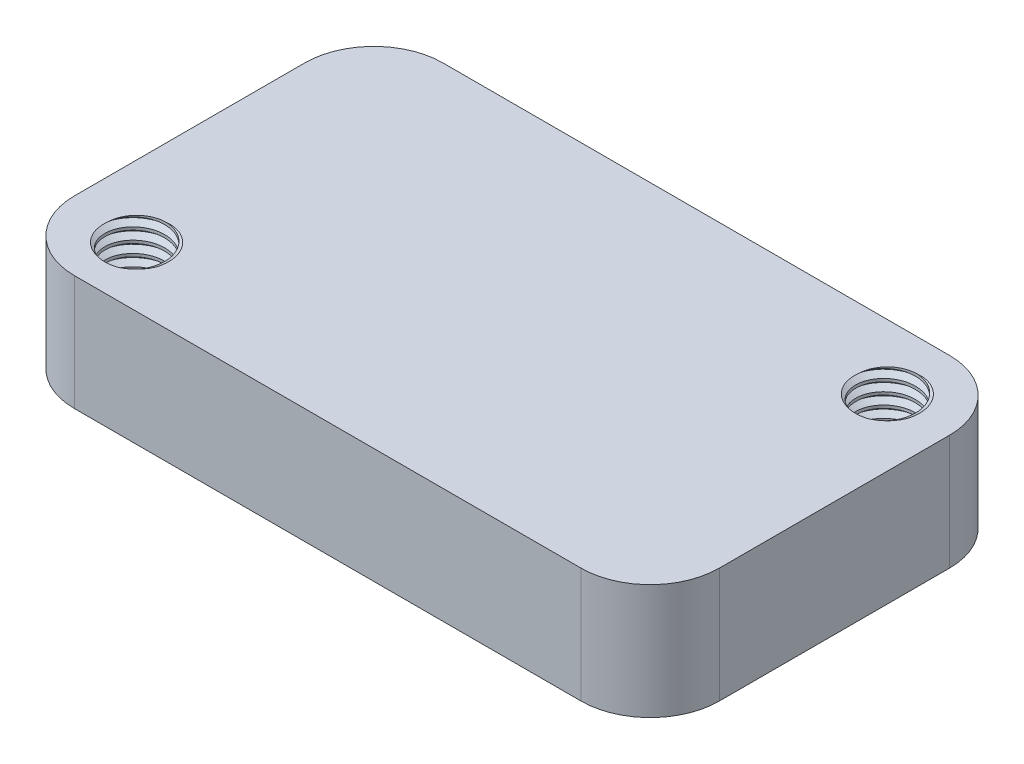
from build123d import *

# Parameters (mm, degrees)
SKETCH1_W           = 28
SKETCH1_H           = 16
SKETCH1_R           = 1.3
BOSS_EXTRUDE1_DEPTH = 5
FILLET1_R           = 3
THREAD1_PITCH       = 0.5
THREAD2_PITCH       = 0.5


with BuildPart() as part:
    # Sketch1 → Boss-Extrude1 (new body)
    with BuildSketch(Plane(origin=(0, 0, 0), x_dir=(1, 0, 0), z_dir=(0, 1, 0))):
        Rectangle(SKETCH1_W, SKETCH1_H)
        with Locations(Location((11, 5.3, 0), (0, 0, 270))):
            Circle(SKETCH1_R, mode=Mode.SUBTRACT)
        with Locations(Location((-11, -5.3, 0), (0, 0, 270))):
            Circle(SKETCH1_R, mode=Mode.SUBTRACT)
    extrude(amount=BOSS_EXTRUDE1_DEPTH)

    # Fillet1
    fillet1_edges = [part.edges().sort_by_distance(p)[0] for p in [
        (14, 2.5, 8),
        (-14, 2.5, 8),
        (-14, 2.5, -8),
        (14, 2.5, -8),
    ]]
    fillet(fillet1_edges, radius=FILLET1_R)

    # Thread1: the profile of Thread Profile1 profile screwed along a right-hand helix of 20 turns, 6 arcs to a turn; built about Z, then put on its axis
    thread1_z = Axis((0, 0, 0), (0, 0, 1))
    thread1_corners = [(1.2997, 0, -0.000173205), (1.570632937, 0, 0.156249999), (1.570632937, 0, 0.218749999), (1.2997, 0, 0.375173204)]
    with BuildLine(mode=Mode.PRIVATE) as thread1_profile:
        Line(thread1_corners[0], thread1_corners[1])
        Line(thread1_corners[1], thread1_corners[2])
        Line(thread1_corners[2], thread1_corners[3])
        Line(thread1_corners[3], thread1_corners[0])
    thread1_cap = Face(thread1_profile.wire())
    thread1_turn_angles = [0, 30, 60, 90, 120, 150, 180, 210, 240, 270, 300, 330, 360]
    thread1_turn_weights = [1, 0.8660254037844387, 1, 0.8660254037844387, 1, 0.8660254037844387, 1, 0.8660254037844387, 1, 0.8660254037844387, 1, 0.8660254037844387, 1]
    thread1_turn_rails = [Edge.make_bspline([Vector(p[0], p[1], 0).rotate(thread1_z, thread1_turn_angles[k]) / thread1_turn_weights[k] + Vector(0, 0, p[2] + THREAD1_PITCH * thread1_turn_angles[k] / 360) for k in range(13)], [0, 0, 0, 1, 1, 2, 2, 3, 3, 4, 4, 5, 5, 6, 6, 6], 2, thread1_turn_weights) for p in thread1_corners]
    thread1_turn_sides = [Face.make_surface_from_curves(thread1_turn_rails[p[0]], thread1_turn_rails[p[1]]) for p in [(0, 1), (1, 2), (2, 3), (3, 0)]]
    thread1 = Plane(origin=(-11, 6, 5.3), x_dir=(-1, 0, 0), z_dir=(0, -1, 0)) * Solid(Shell([*[p.moved(Location((0, 0, THREAD1_PITCH * i))) for i in range(20) for p in thread1_turn_sides], thread1_cap, thread1_cap.rotate(thread1_z, 7200).moved(Location((0, 0, THREAD1_PITCH * 7200 / 360)))]))
    add(thread1, mode=Mode.SUBTRACT)

    # Thread2: the profile of Thread Profile2 profile screwed along a right-hand helix of 20 turns, 6 arcs to a turn; built about Z, then put on its axis
    thread2_z = Axis((0, 0, 0), (0, 0, 1))
    thread2_corners = [(1.2997, 0, -0.000173205), (1.570632937, 0, 0.156249999), (1.570632937, 0, 0.218749999), (1.2997, 0, 0.375173204)]
    with BuildLine(mode=Mode.PRIVATE) as thread2_profile:
        Line(thread2_corners[0], thread2_corners[1])
        Line(thread2_corners[1], thread2_corners[2])
        Line(thread2_corners[2], thread2_corners[3])
        Line(thread2_corners[3], thread2_corners[0])
    thread2_cap = Face(thread2_profile.wire())
    thread2_turn_angles = [0, 30, 60, 90, 120, 150, 180, 210, 240, 270, 300, 330, 360]
    thread2_turn_weights = [1, 0.8660254037844387, 1, 0.8660254037844387, 1, 0.8660254037844387, 1, 0.8660254037844387, 1, 0.8660254037844387, 1, 0.8660254037844387, 1]
    thread2_turn_rails = [Edge.make_bspline([Vector(p[0], p[1], 0).rotate(thread2_z, thread2_turn_angles[k]) / thread2_turn_weights[k] + Vector(0, 0, p[2] + THREAD2_PITCH * thread2_turn_angles[k] / 360) for k in range(13)], [0, 0, 0, 1, 1, 2, 2, 3, 3, 4, 4, 5, 5, 6, 6, 6], 2, thread2_turn_weights) for p in thread2_corners]
    thread2_turn_sides = [Face.make_surface_from_curves(thread2_turn_rails[p[0]], thread2_turn_rails[p[1]]) for p in [(0, 1), (1, 2), (2, 3), (3, 0)]]
    thread2 = Plane(origin=(11, 6, -5.3), x_dir=(-1, 0, 0), z_dir=(0, -1, 0)) * Solid(Shell([*[p.moved(Location((0, 0, THREAD2_PITCH * i))) for i in range(20) for p in thread2_turn_sides], thread2_cap, thread2_cap.rotate(thread2_z, 7200).moved(Location((0, 0, THREAD2_PITCH * 7200 / 360)))]))
    add(thread2, mode=Mode.SUBTRACT)


solid = part.part
